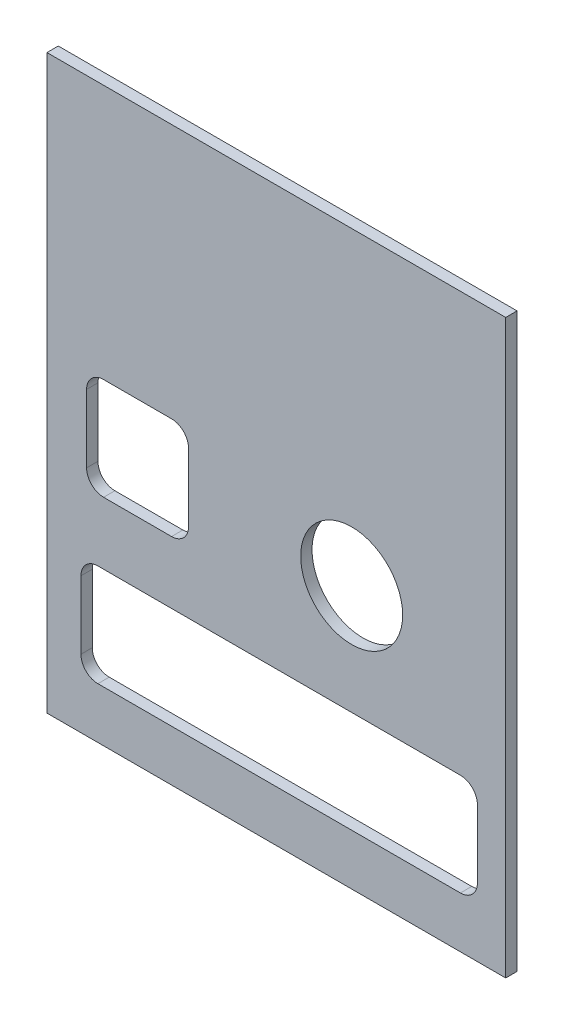
from build123d import *

# Parameters (mm, degrees)
SKETCH1_W           = 81
SKETCH1_H           = 101
BOSS_EXTRUDE1_DEPTH = 2
SKETCH2_R           = 9
CUT_EXTRUDE2_DEPTH  = 2


with BuildPart() as part:
    # Sketch1 → Boss-Extrude1 (new body)
    with BuildSketch(Plane.XY):
        with Locations((-8.394586128, 4.547306085)):
            Rectangle(SKETCH1_W, SKETCH1_H)
    extrude(amount=BOSS_EXTRUDE1_DEPTH)

    # Sketch2 → Cut-Extrude2 (cut)
    with BuildSketch(Plane.XY.offset(2)):
        with Locations((4.905418503, 0.432598952)):
            Circle(SKETCH2_R)
        with BuildLine():
            Line((-39.894586128, -18.952693915), (24.105413872, -18.952693915))
            ThreePointArc((24.105413872, -18.952693915), (26.226734215, -19.831373571), (27.105413872, -21.952693915))
            Line((27.105413872, -21.952693915), (27.105413872, -33.952693915))
            ThreePointArc((27.105413872, -33.952693915), (26.226734215, -36.074014258), (24.105413872, -36.952693915))
            Line((24.105413872, -36.952693915), (-39.894586128, -36.952693915))
            ThreePointArc((-39.894586128, -36.952693915), (-42.015906472, -36.074014258), (-42.894586128, -33.952693915))
            Line((-42.894586128, -33.952693915), (-42.894586128, -21.952693915))
            ThreePointArc((-42.894586128, -21.952693915), (-42.015906472, -19.831373571), (-39.894586128, -18.952693915))
        make_face()
        with BuildLine():
            Line((-38.894586128, 10.047306085), (-26.894586128, 10.047306085))
            ThreePointArc((-26.894586128, 10.047306085), (-24.773265785, 9.168626429), (-23.894586128, 7.047306085))
            Line((-23.894586128, 7.047306085), (-23.894586128, -4.952693915))
            ThreePointArc((-23.894586128, -4.952693915), (-24.773265785, -7.074014258), (-26.894586128, -7.952693915))
            Line((-26.894586128, -7.952693915), (-38.894586128, -7.952693915))
            ThreePointArc((-38.894586128, -7.952693915), (-41.015906472, -7.074014258), (-41.894586128, -4.952693915))
            Line((-41.894586128, -4.952693915), (-41.894586128, 7.047306085))
            ThreePointArc((-41.894586128, 7.047306085), (-41.015906472, 9.168626429), (-38.894586128, 10.047306085))
        make_face()
    extrude(amount=-CUT_EXTRUDE2_DEPTH, mode=Mode.SUBTRACT)


solid = part.part
